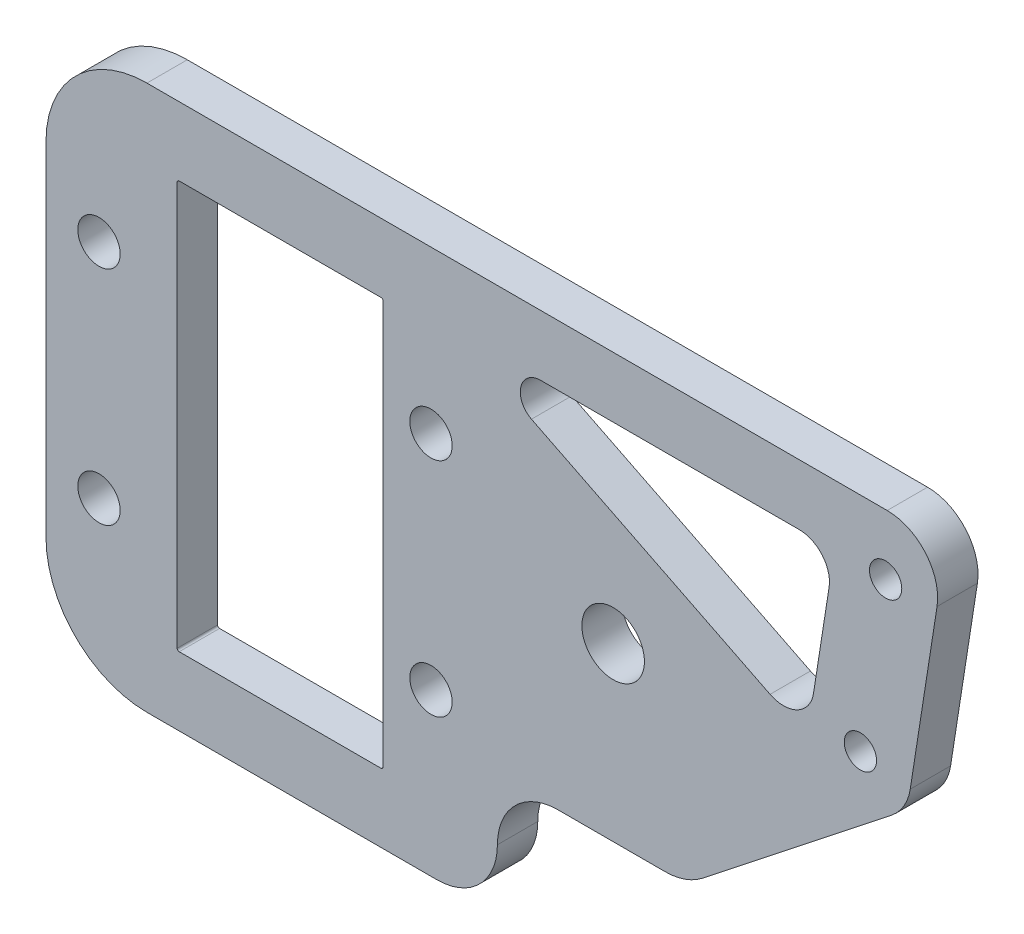
from build123d import *

# Parameters (mm, degrees)
SKETCH_1_R          = 3.1
SKETCH_1_R_2        = 1.6
SKETCH_1_W          = 20.4
SKETCH_1_H          = 40.4
EXTRUDE_1_DEPTH     = 4
FILLET_1_R          = 0.2
SKETCH_2_R          = 2.1
CUT_EXTRUDE_1_DEPTH = 4
CUT_EXTRUDE_2_DEPTH = 10
SKETCH_4_W          = 44.796452611
SKETCH_4_H          = 12
CUT_EXTRUDE_3_DEPTH = 10
FILLET_2_R          = 6


with BuildPart() as part:
    # 草图1 → 凸台-拉伸1 (new body)
    with BuildSketch(Plane.XY):
        with BuildLine():
            Line((-13.2, 27), (60.15625, 27))
            ThreePointArc((60.15625, 27), (63.954895943, 25.251198086), (65.096310169, 21.228115599))
            Line((65.096310169, 21.228115599), (62.440060169, 4.228115599))
            ThreePointArc((62.440060169, 4.228115599), (61.816569536, 2.476663431), (60.596300169, 1.074070141))
            Line((60.596300169, 1.074070141), (27.72371786, -24.851859719))
            ThreePointArc((27.72371786, -24.851859719), (24.808418455, -26.447713935), (21.531117522, -27))
            Line((21.531117522, -27), (-13.2, -27))
            ThreePointArc((-13.2, -27), (-20.271067812, -24.071067812), (-23.2, -17))
            Line((-23.2, -17), (-23.2, 17))
            ThreePointArc((-23.2, 17), (-20.271067812, 24.071067812), (-13.2, 27))
        make_face()
        with Locations((33, 2)):
            Circle(SKETCH_1_R, mode=Mode.SUBTRACT)
        with Locations((60, 21)):
            Circle(SKETCH_1_R_2, mode=Mode.SUBTRACT)
        with Locations((57.5, 5)):
            Circle(SKETCH_1_R_2, mode=Mode.SUBTRACT)
        Rectangle(SKETCH_1_W, SKETCH_1_H, mode=Mode.SUBTRACT)
    extrude(amount=EXTRUDE_1_DEPTH)

    # 圆角1
    fillet_1_edges = [part.edges().sort_by_distance(p)[0] for p in [
        (-10.2, 20.2, 2),
        (-10.2, -20.2, 2),
        (10.2, -20.2, 2),
        (10.2, 20.2, 2),
    ]]
    fillet(fillet_1_edges, radius=FILLET_1_R)

    # 草图2 → 切除-拉伸1 (cut)
    with BuildSketch(Plane.XY.offset(4)):
        with Locations((14.95, 11)):
            Circle(SKETCH_2_R)
        with Locations(Location((14.95, -11, 0), (0, 0, 180))):
            Circle(SKETCH_2_R)
        with Locations((-17.95, -11)):
            Circle(SKETCH_2_R)
        with Locations(Location((-17.95, 11, 0), (0, 0, 180))):
            Circle(SKETCH_2_R)
    extrude(amount=-CUT_EXTRUDE_1_DEPTH, mode=Mode.SUBTRACT)

    # 草图3 → 切除-拉伸2 (cut)
    with BuildSketch(Plane.XY.offset(4)):
        with BuildLine():
            Line((25.798016292, 21), (51.43418263, 21))
            ThreePointArc((51.43418263, 21), (53.713370196, 19.950718852), (54.398218731, 17.536869359))
            Line((54.398218731, 17.536869359), (52.852232934, 7.642560256))
            ThreePointArc((52.852232934, 7.642560256), (51.264559821, 5.440053089), (48.549531682, 5.420923567))
            Line((48.549531682, 5.420923567), (24.905572858, 17.210155114))
            ThreePointArc((24.905572858, 17.210155114), (23.851263897, 19.458426781), (25.798016292, 21))
        make_face()
    extrude(amount=-CUT_EXTRUDE_2_DEPTH, mode=Mode.SUBTRACT)

    # 草图4 → 切除-拉伸3 (cut)
    with BuildSketch(Plane.XY.offset(4)):
        with Locations((43.929343828, -21)):
            Rectangle(SKETCH_4_W, SKETCH_4_H)
    extrude(amount=-CUT_EXTRUDE_3_DEPTH, mode=Mode.SUBTRACT)

    # 圆角2
    fillet_2_edges = [part.edges().sort_by_distance(p)[0] for p in [
        (40.215307217, -15, 2),
        (21.531117522, -27, 2),
        (21.531117522, -15, 2),
    ]]
    fillet(fillet_2_edges, radius=FILLET_2_R - 0.0001)  # a hair under: the kernel refuses the full size


solid = part.part
